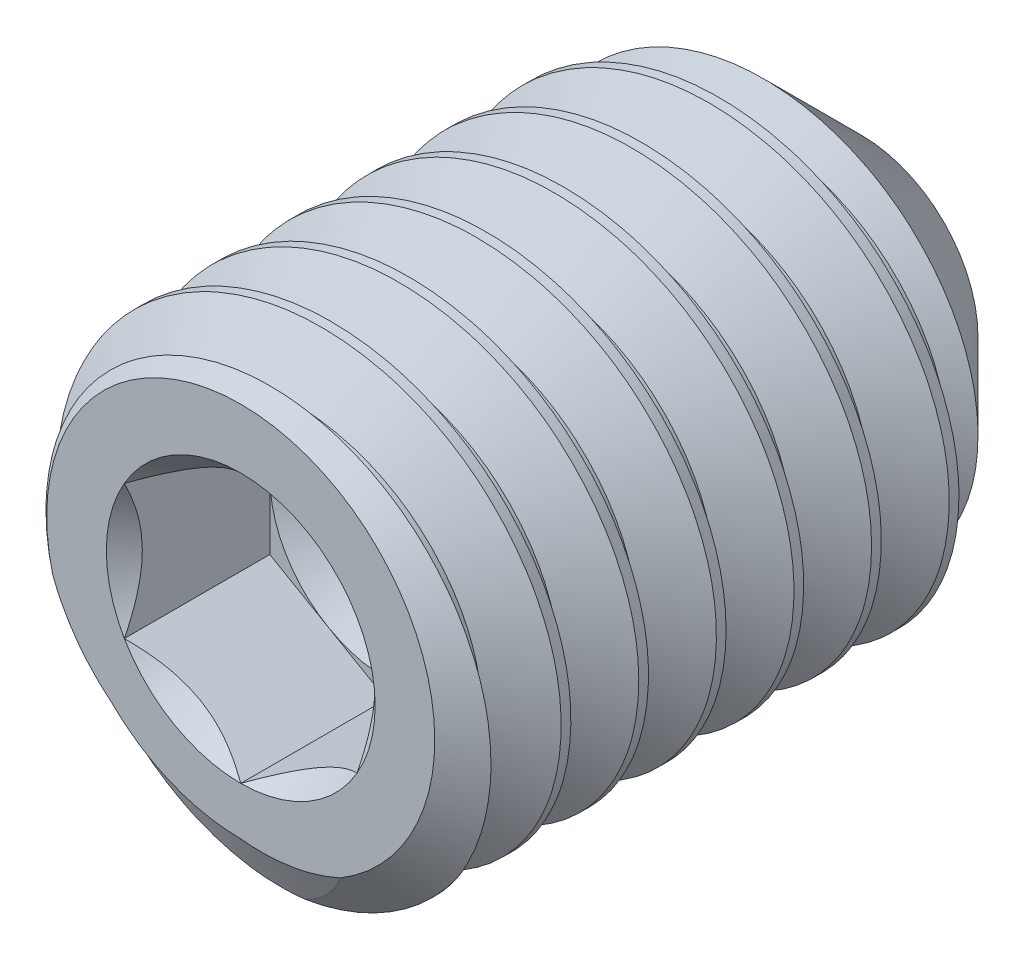
from build123d import *

# Parameters (mm, degrees)
CUT_EXTRUDE1_DEPTH = 1.875
CUT_SWEEP1_PITCH   = 1


with BuildPart() as part:
    # Sketch11 → Revolve1 (revolve)
    with BuildSketch(Plane(origin=(0, 0, 0), x_dir=(0, 0, -1), z_dir=(1, 0, 0)), mode=Mode.PRIVATE) as revolve1_sk:
        Polygon((-4, 0), (-4, 2.5), (-3.649896231, 3), (2.5, 3), (4, 1.5), (3.098709071, 0), align=None)
    revolve(revolve1_sk.sketch.rotate(Axis((0, 0, -3.098709071), (0, 0, -1)), 180), axis=Axis((0, 0, -3.098709071), (0, 0, -1)))

    # Sketch2 → Cut-Extrude1 (cut)
    with BuildSketch(Plane.XY.offset(4)):
        Polygon((0, 1.732050808), (-1.5, 0.866025404), (-1.5, -0.866025404), (0, -1.732050808), (1.5, -0.866025404), (1.5, 0.866025404), align=None)
    extrude(amount=-CUT_EXTRUDE1_DEPTH, mode=Mode.SUBTRACT)

    # Cut-Extrude2 cone 1 section (through the dimple's axis) → Cut-Extrude2 (revolve, cut)
    with BuildSketch(Plane(origin=(0, 0, 4), x_dir=(0, -1, 0), z_dir=(1, 0, 0))):
        Polygon((0, 0), (1.732050808, 0), (0, 1.732050808), align=None)
    revolve(axis=Axis((0, 0, 4), (0, 0, -1)), mode=Mode.SUBTRACT)

    # Cut-Extrude3 cone 1 section (through the dimple's axis) → Cut-Extrude3 (revolve, cut)
    with BuildSketch(Plane(origin=(0, 0, 2.125), x_dir=(0, -1, 0), z_dir=(1, 0, 0))):
        Polygon((0, 0), (1.5, 0), (0, 0.866025404), align=None)
    revolve(axis=Axis((0, 0, 2.125), (0, 0, -1)), mode=Mode.SUBTRACT)

    # Cut-Sweep1: the profile of Sketch6 screwed along a right-hand helix of 8.8 turns, 8 arcs to a turn; built about Z, then put on its axis
    cut_sweep1_z = Axis((0, 0, 0), (0, 0, 1))
    cut_sweep1_corners = [(3.054126588, 0, 0.03125), (3.054126588, 0, -0.90625), (2.350480947, 0, -0.5), (2.350480947, 0, -0.375)]
    with BuildLine(mode=Mode.PRIVATE) as cut_sweep1_profile:
        Line(cut_sweep1_corners[0], cut_sweep1_corners[1])
        Line(cut_sweep1_corners[1], cut_sweep1_corners[2])
        Line(cut_sweep1_corners[2], cut_sweep1_corners[3])
        Line(cut_sweep1_corners[3], cut_sweep1_corners[0])
    cut_sweep1_cap = Face(cut_sweep1_profile.wire())
    cut_sweep1_turn_angles = [0, 22.5, 45, 67.5, 90, 112.5, 135, 157.5, 180, 202.5, 225, 247.5, 270, 292.5, 315, 337.5, 360]
    cut_sweep1_turn_weights = [1, 0.9238795325112867, 1, 0.9238795325112867, 1, 0.9238795325112867, 1, 0.9238795325112867, 1, 0.9238795325112867, 1, 0.9238795325112867, 1, 0.9238795325112867, 1, 0.9238795325112867, 1]
    cut_sweep1_turn_rails = [Edge.make_bspline([Vector(p[0], p[1], 0).rotate(cut_sweep1_z, cut_sweep1_turn_angles[k]) / cut_sweep1_turn_weights[k] + Vector(0, 0, p[2] + CUT_SWEEP1_PITCH * cut_sweep1_turn_angles[k] / 360) for k in range(17)], [0, 0, 0, 1, 1, 2, 2, 3, 3, 4, 4, 5, 5, 6, 6, 7, 7, 8, 8, 8], 2, cut_sweep1_turn_weights) for p in cut_sweep1_corners]
    cut_sweep1_turn_sides = [Face.make_surface_from_curves(cut_sweep1_turn_rails[p[0]], cut_sweep1_turn_rails[p[1]]) for p in [(0, 1), (1, 2), (2, 3), (3, 0)]]
    cut_sweep1_last_angles = [2880, 2902.5, 2925, 2947.5, 2970, 2992.5, 3015, 3037.5, 3060, 3082.5, 3105, 3127.5, 3150, 3159, 3168]
    cut_sweep1_last_weights = [1, 0.9238795325112867, 1, 0.9238795325112867, 1, 0.9238795325112867, 1, 0.9238795325112867, 1, 0.9238795325112867, 1, 0.9238795325112867, 1, 0.9876883405951036, 1]
    cut_sweep1_last_rails = [Edge.make_bspline([Vector(p[0], p[1], 0).rotate(cut_sweep1_z, cut_sweep1_last_angles[k]) / cut_sweep1_last_weights[k] + Vector(0, 0, p[2] + CUT_SWEEP1_PITCH * cut_sweep1_last_angles[k] / 360) for k in range(15)], [0, 0, 0, 1, 1, 2, 2, 3, 3, 4, 4, 5, 5, 6, 6, 7, 7, 7], 2, cut_sweep1_last_weights) for p in cut_sweep1_corners]
    cut_sweep1_last_sides = [Face.make_surface_from_curves(cut_sweep1_last_rails[p[0]], cut_sweep1_last_rails[p[1]]) for p in [(0, 1), (1, 2), (2, 3), (3, 0)]]
    cut_sweep1 = Plane(origin=(0, 0, -4), x_dir=(0, 1, 0), z_dir=(0, 0, 1)) * Solid(Shell([*[p.moved(Location((0, 0, CUT_SWEEP1_PITCH * i))) for i in range(8) for p in cut_sweep1_turn_sides], *cut_sweep1_last_sides, cut_sweep1_cap, cut_sweep1_cap.rotate(cut_sweep1_z, 3168).moved(Location((0, 0, CUT_SWEEP1_PITCH * 3168 / 360)))]))
    add(cut_sweep1, mode=Mode.SUBTRACT)


solid = part.part
